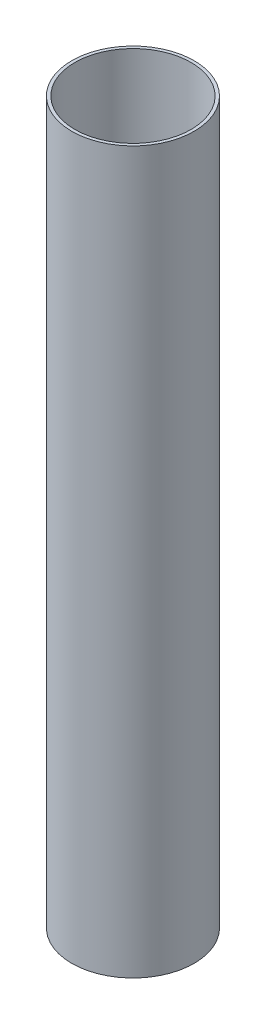
from build123d import *

# Parameters (mm, degrees)
SKETCH1_R           = 33.9725
SKETCH1_R_2         = 32.258
BOSS_EXTRUDE1_DEPTH = 400


with BuildPart() as part:
    # Sketch1 → Boss-Extrude1 (new body)
    with BuildSketch(Plane(origin=(0, 0, 0), x_dir=(1, 0, 0), z_dir=(0, 1, 0))):
        Circle(SKETCH1_R)
        Circle(SKETCH1_R_2, mode=Mode.SUBTRACT)
    extrude(amount=BOSS_EXTRUDE1_DEPTH)


solid = part.part
